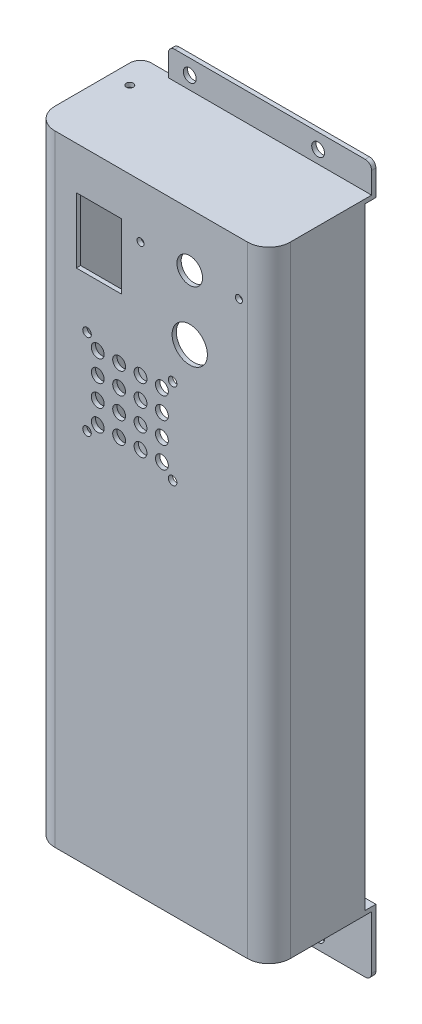
from build123d import *

# Parameters (mm, degrees)
SM_BASE_FLANGE_1_DEPTH      = 145
EXTRUDE_1_DEPTH             = 2
SKETCH_4_W                  = 95
SKETCH_4_H                  = 13
SKETCH_4_H_2                = 28
EXTRUDE_2_DEPTH             = 2
SKETCH_5_R                  = 3
CUT_EXTRUDE_1_DEPTH         = 188.771137292
FILLET_1_R                  = 3
SKETCH_6_W                  = 8
SKETCH_6_H                  = 286
EXTRUDE_3_DEPTH             = 2
SKETCH_13_W                 = 88
SKETCH_13_H                 = 22
CUT_EXTRUDE_2_DEPTH         = 2
FILLET_2_R                  = 5
SKETCH_14_R                 = 4
EXTRUDE_4_DEPTH             = 3
SKETCH_17_W                 = 21
SKETCH_17_H                 = 30.5
CUT_EXTRUDE_3_DEPTH         = 2
SKETCH_18_R                 = 6
SKETCH_18_R_2               = 1.65
CUT_EXTRUDE_4_DEPTH         = 189.292325919
SKETCH_19_R                 = 2
CUT_EXTRUDE_5_DEPTH         = 189.292325919
SKETCH_20_R                 = 8.25
CUT_EXTRUDE_6_DEPTH         = 189.292325919
SKETCH_23_R                 = 3
CUT_EXTRUDE_9_DEPTH         = 189.292325919
PATTERN_LINEAR_1_COUNT      = 4
PATTERN_LINEAR_1_PITCH      = 10
PATTERN_LINEAR_1_COUNT_DIR2 = 4
PATTERN_LINEAR_1_PITCH_DIR2 = 10
SKETCH_24_W                 = 5
SKETCH_24_H                 = 286
CUT_EXTRUDE_10_DEPTH        = 212.018956494
SKETCH_25_W                 = 10
SKETCH_25_H                 = 286
EXTRUDE_5_DEPTH             = 2
FILLET_3_R                  = 5


# Sheet-metal steps are written as plain solids
with BuildPart() as part:
    # Sketch 1 → 基体-法兰1 (new, symmetric)
    with BuildSketch(Plane(origin=(0, 0, 0), x_dir=(1, 0, 0), z_dir=(0, 1, 0))):
        with BuildLine():
            Line((55, 50), (55, 10))
            ThreePointArc((55, 10), (52.071067812, 2.928932188), (45, 0))
            Line((45, 0), (-45, 0))
            ThreePointArc((-45, 0), (-52.071067812, 2.928932188), (-55, 10))
            Line((-55, 10), (-55, 50))
            Line((-55, 50), (-53, 50))
            Line((-53, 50), (-53, 10))
            ThreePointArc((-53, 10), (-50.656854249, 4.343145751), (-45, 2))
            Line((-45, 2), (45, 2))
            ThreePointArc((45, 2), (50.656854249, 4.343145751), (53, 10))
            Line((53, 10), (53, 50))
            Line((53, 50), (55, 50))
        make_face()
    extrude(amount=SM_BASE_FLANGE_1_DEPTH, both=True)

    # 草图3 → 凸台-拉伸1 (add)
    with BuildSketch(Plane(origin=(0, 145, 0), x_dir=(1, 0, 0), z_dir=(0, 1, 0))):
        with BuildLine():
            Line((53, 50), (53, 10))
            ThreePointArc((53, 10), (50.656854249, 4.343145751), (45, 2))
            Line((45, 2), (-45, 2))
            ThreePointArc((-45, 2), (-50.656854249, 4.343145751), (-53, 10))
            Line((-53, 10), (-53, 50))
            Line((-53, 50), (53, 50))
        make_face()
    extrude_1 = extrude(amount=-EXTRUDE_1_DEPTH)

    # 草图4 → 凸台-拉伸2 (add)
    with BuildSketch(Plane(origin=(0, 0, -50), x_dir=(-1, 0, 0), z_dir=(0, 0, -1))):
        with Locations((-7.5, 151.5)):
            Rectangle(SKETCH_4_W, SKETCH_4_H)
        with Locations((-7.5, -159)):
            Rectangle(SKETCH_4_W, SKETCH_4_H_2)
    extrude(amount=-EXTRUDE_2_DEPTH)

    # 草图5 → 切除-拉伸1 (cut, through all)
    with BuildSketch(Plane.XY.offset(-48)):
        with Locations((30, 151)):
            Circle(SKETCH_5_R)
        with Locations((-30, 151)):
            Circle(SKETCH_5_R)
        with Locations((30, -167)):
            Circle(SKETCH_5_R)
        with Locations((-30, -167)):
            Circle(SKETCH_5_R)
    extrude(amount=-CUT_EXTRUDE_1_DEPTH, mode=Mode.SUBTRACT)

    # 圆角1
    fillet_1_edges = [part.edges().sort_by_distance(p)[0] for p in [
        (55, 158, -49),
        (-40, 158, -49),
        (55, -173, -49),
        (-40, -173, -49),
    ]]
    fillet(fillet_1_edges, radius=FILLET_1_R)

    # 镜向1: 凸台-拉伸1 across plane
    add(extrude_1.mirror(Plane.ZX))

    # 草图6 → 凸台-拉伸3 (add)
    with BuildSketch(Plane(origin=(0, 0, -50), x_dir=(-1, 0, 0), z_dir=(0, 0, -1))):
        with Locations((-49, 0)):
            Rectangle(SKETCH_6_W, SKETCH_6_H)
        with Locations((49, 0)):
            Rectangle(SKETCH_6_W, SKETCH_6_H)
    extrude(amount=-EXTRUDE_3_DEPTH)

    # 草图11 → M4x0.7 螺纹孔1 (revolve, cut)
    with BuildSketch(Plane(origin=(-46, 145, -36), x_dir=(0, 0, 1), z_dir=(1, 0, 0))):
        Polygon((0, 0), (0, 11.091420021), (1.65, 10.1), (1.65, 0), align=None)
    m4x0_7_1 = revolve(axis=Axis((-46, 151.35, -36), (0, -1, 0)), mode=Mode.SUBTRACT)

    # 镜向2: M4x0.7 螺纹孔1 across plane
    add(m4x0_7_1.mirror(Plane.ZX), mode=Mode.SUBTRACT)

    # 草图13 → 切除-拉伸2 (cut)
    with BuildSketch(Plane.XZ.offset(145)):
        with Locations((-1, -20)):
            Rectangle(SKETCH_13_W, SKETCH_13_H)
    extrude(amount=-CUT_EXTRUDE_2_DEPTH, mode=Mode.SUBTRACT)

    # 圆角2
    fillet_2_edges = [part.edges().sort_by_distance(p)[0] for p in [
        (43, -144, -31),
        (43, -144, -9),
        (-45, -144, -9),
        (-45, -144, -31),
    ]]
    fillet(fillet_2_edges, radius=FILLET_2_R)

    # 草图14 → 凸台-拉伸4 (add)
    with BuildSketch(Plane(origin=(0, 0, -2), x_dir=(-1, 0, 0), z_dir=(0, 0, -1))):
        with Locations((-30, -108)):
            Circle(SKETCH_14_R)
        with Locations((30, -108)):
            Circle(SKETCH_14_R)
        with Locations((-30, -18)):
            Circle(SKETCH_14_R)
        with Locations((30, -18)):
            Circle(SKETCH_14_R)
    extrude(amount=EXTRUDE_4_DEPTH)

    # 草图17 → 切除-拉伸3 (cut)
    with BuildSketch(Plane.XY):
        with Locations((-24.5, 109.75)):
            Rectangle(SKETCH_17_W, SKETCH_17_H)
    extrude(amount=-CUT_EXTRUDE_3_DEPTH, mode=Mode.SUBTRACT)

    # 草图18 → 切除-拉伸4 (cut, through all)
    with BuildSketch(Plane.XY):
        with Locations((18, 120)):
            Circle(SKETCH_18_R)
        with Locations((-5, 120)):
            Circle(SKETCH_18_R_2)
        with Locations((41, 120)):
            Circle(SKETCH_18_R_2)
    extrude(amount=-CUT_EXTRUDE_4_DEPTH, mode=Mode.SUBTRACT)

    # 草图19 → 切除-拉伸5 (cut, through all)
    with BuildSketch(Plane.XY):
        with Locations((-30, 71)):
            Circle(SKETCH_19_R)
        with Locations((10, 71)):
            Circle(SKETCH_19_R)
        with Locations((-30, 31)):
            Circle(SKETCH_19_R)
        with Locations((10, 31)):
            Circle(SKETCH_19_R)
    extrude(amount=-CUT_EXTRUDE_5_DEPTH, mode=Mode.SUBTRACT)

    # 草图20 → 切除-拉伸6 (cut, through all)
    with BuildSketch(Plane.XY):
        with Locations((18, 90)):
            Circle(SKETCH_20_R)
    extrude(amount=-CUT_EXTRUDE_6_DEPTH, mode=Mode.SUBTRACT)

    # 草图23 → 切除-拉伸9 (cut, through all)
    with BuildSketch(Plane.XY):
        with Locations((-25, 66)):
            Circle(SKETCH_23_R)
    cut_extrude_9 = extrude(amount=-CUT_EXTRUDE_9_DEPTH, mode=Mode.SUBTRACT)

    # 阵列(线性)1: Cut-Extrude 9 4 × 4
    with Locations(*[(i * PATTERN_LINEAR_1_PITCH, -j * PATTERN_LINEAR_1_PITCH_DIR2, 0) for i in range(PATTERN_LINEAR_1_COUNT) for j in range(PATTERN_LINEAR_1_COUNT_DIR2) if (i, j) != (0, 0)]):
        add(cut_extrude_9, mode=Mode.SUBTRACT)

    # 草图24 → 切除-拉伸10 (cut, through all)
    with BuildSketch(Plane(origin=(55, 0, 0), x_dir=(0, 0, -1), z_dir=(1, 0, 0))):
        with Locations((47.5, 0)):
            Rectangle(SKETCH_24_W, SKETCH_24_H)
    extrude(amount=-CUT_EXTRUDE_10_DEPTH, mode=Mode.SUBTRACT)

    # 草图25 → 凸台-拉伸5 (add)
    with BuildSketch(Plane(origin=(0, 0, -45), x_dir=(-1, 0, 0), z_dir=(0, 0, -1))):
        with Locations((-50, 0)):
            Rectangle(SKETCH_25_W, SKETCH_25_H)
        with Locations((50, 0)):
            Rectangle(SKETCH_25_W, SKETCH_25_H)
    extrude(amount=-EXTRUDE_5_DEPTH)

    # 圆角3
    fillet_3_edges = [part.edges().sort_by_distance(p)[0] for p in [
        (-55, 144, -50),
        (-55, -144, -50),
    ]]
    fillet(fillet_3_edges, radius=FILLET_3_R)


solid = part.part
